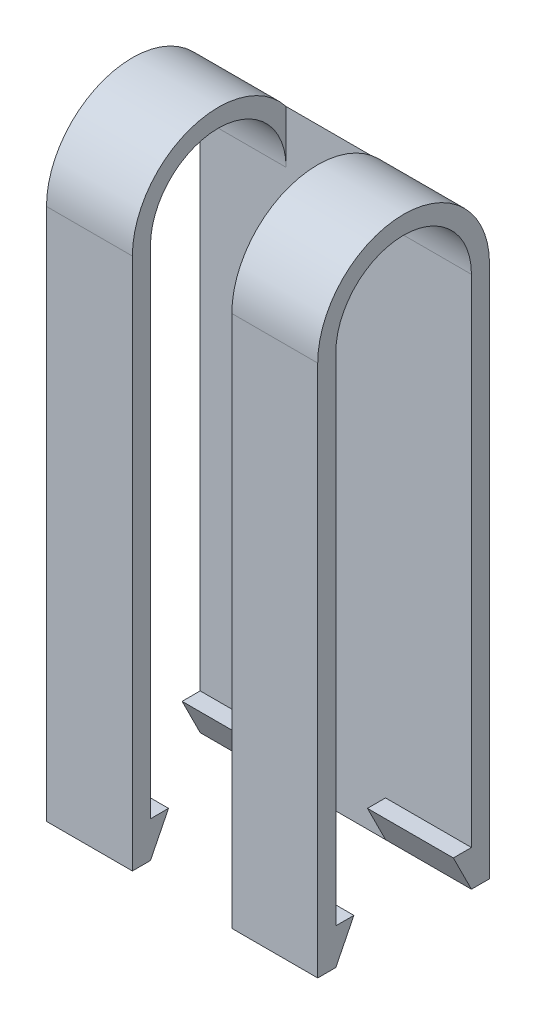
from build123d import *

# Parameters (mm, degrees)
BOSS_EXTRUDE1_DEPTH = 30
SKETCH2_W           = 11
SKETCH2_H           = 68.4
CUT_EXTRUDE1_DEPTH  = 17


with BuildPart() as part:
    # Sketch1 → Boss-Extrude1 (new body)
    with BuildSketch(Plane(origin=(0, 0, 0), x_dir=(0, 0, -1), z_dir=(1, 0, 0))):
        with BuildLine():
            Line((-2, 0), (0, 0))
            Line((0, 0), (2, 4))
            Line((2, 4), (0, 4))
            Line((0, 4), (0, 58.9))
            ThreePointArc((0, 58.9), (7.5, 66.4), (15, 58.9))
            Line((15, 58.9), (15, 4))
            Line((15, 4), (13, 4))
            Line((13, 4), (15, 0))
            Line((15, 0), (17, 0))
            Line((17, 0), (17, 58.9))
            ThreePointArc((17, 58.9), (7.5, 68.4), (-2, 58.9))
            Line((-2, 58.9), (-2, 0))
        make_face()
    extrude(amount=-BOSS_EXTRUDE1_DEPTH)

    # Sketch2 → Cut-Extrude1 (cut)
    with BuildSketch(Plane.XY.offset(2)):
        with Locations((-15, 34.2)):
            Rectangle(SKETCH2_W, SKETCH2_H)
    extrude(amount=-CUT_EXTRUDE1_DEPTH, mode=Mode.SUBTRACT)


solid = part.part
